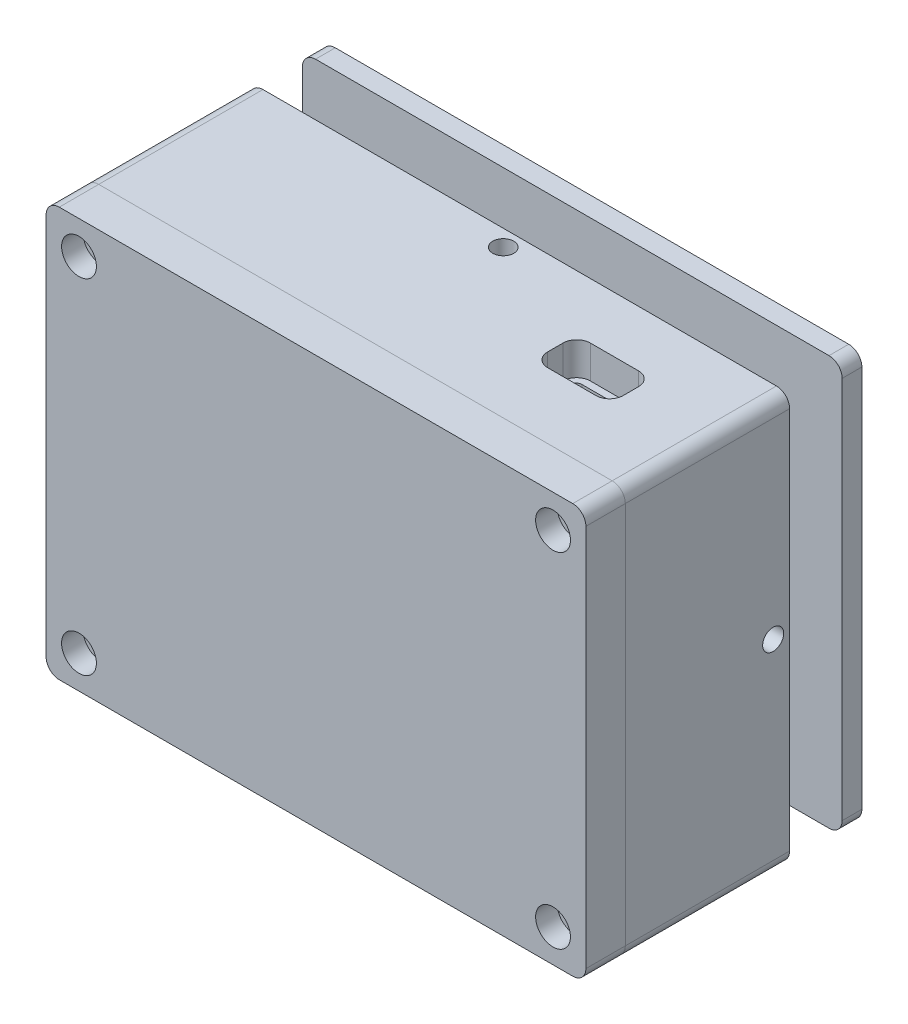
from build123d import *
from OCP.BRepFilletAPI import BRepFilletAPI_MakeChamfer

# Parameters (mm, degrees)
SKETCH1_W                = 70
SKETCH1_H                = 50
BOSS_EXTRUDE1_DEPTH      = 2
BOSS_EXTRUDE2_DEPTH      = 21
EXTRUDE_THIN1_DEPTH      = 10
EXTRUDE_THIN1_DEPTH_BACK = 23
SKETCH3_W                = 82.141201594
SKETCH3_H                = 62.29
SKETCH3_W_2              = 76.141201594
SKETCH3_H_2              = 56.29
SKETCH4_W                = 76.141201594
SKETCH4_H                = 56.29
BOSS_EXTRUDE3_DEPTH      = 6
FILLET1_R                = 2
BOSS_EXTRUDE4_DEPTH      = 3
BOSS_EXTRUDE8_DEPTH      = 10
CUT_EXTRUDE1_DEPTH       = 8
CUT_EXTRUDE2_DEPTH       = 8
EXTRUDE_THIN2_DEPTH      = 6
BOSS_EXTRUDE9_START      = 2
BOSS_EXTRUDE9_DEPTH      = 1
FILLET2_R                = 3
SKETCH11_R               = 1.8
CUT_EXTRUDE3_DEPTH       = 5
CUT_EXTRUDE4_DEPTH       = 88.160559078
CUT_EXTRUDE4_DEPTH_BACK  = 88.160559078
SKETCH12_R               = 1.6
CUT_EXTRUDE5_DEPTH       = 92.040453046
CUT_EXTRUDE5_DEPTH_BACK  = 92.040453046
SKETCH13_R               = 1.6
SKETCH14_R               = 1.6
BOSS_EXTRUDE10_DEPTH     = 5
BOSS_EXTRUDE11_DEPTH     = 1
CHAMFER1_SIZE            = 4
CHAMFER1_SIZE2           = 2.309401077
SKETCH16_R               = 1.6
CUT_EXTRUDE6_DEPTH       = 75.13572722
SKETCH17_R               = 2.65
CUT_EXTRUDE7_DEPTH       = 3.3


with BuildPart() as part:
    # Sketch1 → Boss-Extrude1 (new body)
    with BuildSketch(Plane.XY):
        with Locations((-17.311659193, -1.674887892)):
            Rectangle(SKETCH1_W, SKETCH1_H)
    extrude(amount=BOSS_EXTRUDE1_DEPTH)

    # Sketch2 → Boss-Extrude2 (add)
    with BuildSketch(Plane.XY.offset(2)):
        Polygon((-42.790623702, 27.325112108), (-53.311659193, 9.150739706), (12.029536823, -28.674887892), (22.550572314, -10.500515491), align=None)
    extrude(amount=BOSS_EXTRUDE2_DEPTH)


with BuildPart() as body_2:
    # Sketch3 → Extrude-Thin1 (new, two sides: drawn at the far end of the back side and taken through both)
    with BuildSketch(Plane(origin=(0, 0, 0), x_dir=(-1, 0, 0), z_dir=(0, 0, -1)).offset(-EXTRUDE_THIN1_DEPTH_BACK)):
        with Locations((15.391058396, -0.669887892)):
            Rectangle(SKETCH3_W, SKETCH3_H)
        with Locations((15.391058396, -0.669887892)):
            Rectangle(SKETCH3_W_2, SKETCH3_H_2, mode=Mode.SUBTRACT)
    extrude(amount=EXTRUDE_THIN1_DEPTH + EXTRUDE_THIN1_DEPTH_BACK)

    # Sketch4 → Boss-Extrude3 (add)
    with BuildSketch(Plane.XY.offset(23)):
        with Locations((-15.391058396, -0.669887892)):
            Rectangle(SKETCH4_W, SKETCH4_H)
        Polygon((-42.790623702, 27.325112108), (-53.311659193, 9.150739706), (12.029536823, -28.674887892), (22.550572314, -10.500515491), align=None, mode=Mode.SUBTRACT)
    extrude(amount=-BOSS_EXTRUDE3_DEPTH)

    # Fillet1
    fillet1_edges = [body_2.edges().sort_by_distance(p)[0] for p in [
        (-56.461659193, 30.475112108, 6.5),
        (-56.461659193, -31.814887892, 6.5),
        (25.679542401, -31.814887892, 6.5),
        (25.679542401, 30.475112108, 6.5),
    ]]
    fillet(fillet1_edges, radius=FILLET1_R)

    # Sketch6 → Boss-Extrude8 (add)
    with BuildSketch(Plane(origin=(0, 0, 17), x_dir=(-1, 0, 0), z_dir=(0, 0, -1))):
        Polygon((-16.679542401, 27.475112108), (-22.679542401, 22.532519231), (-22.679542401, 27.475112108), align=None)
        Polygon((42.790623702, 27.325112108), (53.311659193, 9.150739706), (53.461659193, 27.475112108), (42.790623702, 27.475112108), align=None)
        Polygon((-12.029536823, -28.674887892), (-22.550572314, -10.500515491), (-22.679542401, -10.500515491), (-22.679542401, -28.814887892), (53.461659193, -28.814887892), (53.461659193, -25.814887892), (-7.089081569, -25.814887892), align=None)
    extrude(amount=BOSS_EXTRUDE8_DEPTH)

    # Sketch7 → Cut-Extrude1 (cut)
    with BuildSketch(Plane(origin=(0, 0, -10), x_dir=(-1, 0, 0), z_dir=(0, 0, -1))):
        Polygon((-28.614884021, 33.287753378), (-28.614884021, -37.390774311), (75.821884566, -37.390774311), (71.624058107, 45.166479381), align=None)
    extrude(amount=-CUT_EXTRUDE1_DEPTH, mode=Mode.SUBTRACT)

    # Sketch8 → Cut-Extrude2 (cut)
    with BuildSketch(Plane(origin=(0, 30.475112108, 0), x_dir=(1, 0, 0), z_dir=(0, 1, 0))):
        with BuildLine():
            Line((1.779542401, -8.574068331), (1.779542401, -10.925931669))
            ThreePointArc((1.779542401, -10.925931669), (2.38702295, -12.392519451), (3.853610732, -13))
            Line((3.853610732, -13), (11.20547407, -13))
            ThreePointArc((11.20547407, -13), (12.672061852, -12.392519451), (13.279542401, -10.925931669))
            Line((13.279542401, -10.925931669), (13.279542401, -8.574068331))
            ThreePointArc((13.279542401, -8.574068331), (12.672061852, -7.107480549), (11.20547407, -6.5))
            Line((11.20547407, -6.5), (3.853610732, -6.5))
            ThreePointArc((3.853610732, -6.5), (2.38702295, -7.107480549), (1.779542401, -8.574068331))
        make_face()
    extrude(amount=-CUT_EXTRUDE2_DEPTH, mode=Mode.SUBTRACT)

    # Sketch8<2> → Extrude-Thin2 (add)
    with BuildSketch(Plane(origin=(0, 30.475112108, 0), x_dir=(1, 0, 0), z_dir=(0, 1, 0))):
        with BuildLine():
            Line((-0.220457599, -8.574068331), (-0.220457599, -10.925931669))
            ThreePointArc((-0.220457599, -10.925931669), (0.972809388, -13.806733013), (3.853610732, -15))
            Line((3.853610732, -15), (11.20547407, -15))
            ThreePointArc((11.20547407, -15), (14.086275414, -13.806733013), (15.279542401, -10.925931669))
            Line((15.279542401, -10.925931669), (15.279542401, -8.574068331))
            ThreePointArc((15.279542401, -8.574068331), (14.086275414, -5.693266987), (11.20547407, -4.5))
            Line((11.20547407, -4.5), (3.853610732, -4.5))
            ThreePointArc((3.853610732, -4.5), (0.972809388, -5.693266987), (-0.220457599, -8.574068331))
        make_face()
        with BuildLine():
            Line((1.779542401, -8.574068331), (1.779542401, -10.925931669))
            ThreePointArc((1.779542401, -10.925931669), (2.38702295, -12.392519451), (3.853610732, -13))
            Line((3.853610732, -13), (11.20547407, -13))
            ThreePointArc((11.20547407, -13), (12.672061852, -12.392519451), (13.279542401, -10.925931669))
            Line((13.279542401, -10.925931669), (13.279542401, -8.574068331))
            ThreePointArc((13.279542401, -8.574068331), (12.672061852, -7.107480549), (11.20547407, -6.5))
            Line((11.20547407, -6.5), (3.853610732, -6.5))
            ThreePointArc((3.853610732, -6.5), (2.38702295, -7.107480549), (1.779542401, -8.574068331))
        make_face(mode=Mode.SUBTRACT)
    extrude(amount=-EXTRUDE_THIN2_DEPTH)

    # Sketch10 → Boss-Extrude9 (add)
    with BuildSketch(Plane.XZ.offset(-27.475112108).offset(BOSS_EXTRUDE9_START)):
        with BuildLine():
            Line((1.779542401, 8.574068331), (1.779542401, 10.925931669))
            ThreePointArc((1.779542401, 10.925931669), (2.38702295, 12.392519451), (3.853610732, 13))
            Line((3.853610732, 13), (11.20547407, 13))
            ThreePointArc((11.20547407, 13), (12.672061852, 12.392519451), (13.279542401, 10.925931669))
            Line((13.279542401, 10.925931669), (13.279542401, 8.574068331))
            ThreePointArc((13.279542401, 8.574068331), (12.672061852, 7.107480549), (11.20547407, 6.5))
            Line((11.20547407, 6.5), (3.853610732, 6.5))
            ThreePointArc((3.853610732, 6.5), (2.38702295, 7.107480549), (1.779542401, 8.574068331))
        make_face()
        with BuildLine():
            Line((3.679542401, 11.9), (11.379542401, 11.9))
            ThreePointArc((11.379542401, 11.9), (12.086649182, 11.607106781), (12.379542401, 10.9))
            Line((12.379542401, 10.9), (12.379542401, 8.6))
            ThreePointArc((12.379542401, 8.6), (12.086649182, 7.892893219), (11.379542401, 7.6))
            Line((11.379542401, 7.6), (3.679542401, 7.6))
            ThreePointArc((3.679542401, 7.6), (2.97243562, 7.892893219), (2.679542401, 8.6))
            Line((2.679542401, 8.6), (2.679542401, 10.9))
            ThreePointArc((2.679542401, 10.9), (2.97243562, 11.607106781), (3.679542401, 11.9))
        make_face(mode=Mode.SUBTRACT)
    extrude(amount=BOSS_EXTRUDE9_DEPTH)

    # Fillet2
    # the kernel refuses this fillet: 3 mm, written as the material it takes off along each edge
    with BuildSketch(Plane(origin=(3.853610732, 24.475112108, 15), x_dir=(0, 1, 0), z_dir=(1, 0, 0)), Plane(origin=(11.20547407, 24.475112108, 4.5), x_dir=(0, 1, 0), z_dir=(-1, 0, 0))) as fillet2_piece_1:
        with BuildLine():
            CenterArc((FILLET2_R, -FILLET2_R), FILLET2_R, 90, 90)
            Line((0, -FILLET2_R), (0, 0))
            Line((0, 0), (FILLET2_R, 0))
        make_face()
    extrude(amount=7.351863339, mode=Mode.SUBTRACT)
    with BuildSketch(Plane(origin=(11.20547407, 24.475112108, 10.925931669), x_dir=(0, 0, 1), z_dir=(-1, 0, 0))) as fillet2_piece_2:
        with BuildLine():
            CenterArc((4.074068331 - FILLET2_R, FILLET2_R), FILLET2_R, 270, 90)
            Line((4.074068331 - FILLET2_R, 0), (4.074068331, 0))
            Line((4.074068331, 0), (4.074068331, FILLET2_R))
        make_face()
    revolve(axis=Axis((11.20547407, 24.475112108, 10.925931669), (0, 1, 0)), revolution_arc=90, mode=Mode.SUBTRACT)
    with BuildSketch(Plane(origin=(11.20547407, 24.475112108, 8.574068331), x_dir=(1, 0, 0), z_dir=(0, 0, 1))) as fillet2_piece_3:
        with BuildLine():
            CenterArc((4.074068331 - FILLET2_R, FILLET2_R), FILLET2_R, 270, 90)
            Line((4.074068331 - FILLET2_R, 0), (4.074068331, 0))
            Line((4.074068331, 0), (4.074068331, FILLET2_R))
        make_face()
    revolve(axis=Axis((11.20547407, 24.475112108, 8.574068331), (0, 1, 0)), revolution_arc=90, mode=Mode.SUBTRACT)
    with BuildSketch(Plane(origin=(3.853610732, 24.475112108, 8.574068331), x_dir=(0, 0, -1), z_dir=(1, 0, 0))) as fillet2_piece_4:
        with BuildLine():
            CenterArc((4.074068331 - FILLET2_R, FILLET2_R), FILLET2_R, 270, 90)
            Line((4.074068331 - FILLET2_R, 0), (4.074068331, 0))
            Line((4.074068331, 0), (4.074068331, FILLET2_R))
        make_face()
    revolve(axis=Axis((3.853610732, 24.475112108, 8.574068331), (0, 1, 0)), revolution_arc=90, mode=Mode.SUBTRACT)
    with BuildSketch(Plane(origin=(3.853610732, 24.475112108, 10.925931669), x_dir=(-1, 0, 0), z_dir=(0, 0, -1))) as fillet2_piece_5:
        with BuildLine():
            CenterArc((4.074068331 - FILLET2_R, FILLET2_R), FILLET2_R, 270, 90)
            Line((4.074068331 - FILLET2_R, 0), (4.074068331, 0))
            Line((4.074068331, 0), (4.074068331, FILLET2_R))
        make_face()
    revolve(axis=Axis((3.853610732, 24.475112108, 10.925931669), (0, 1, 0)), revolution_arc=90, mode=Mode.SUBTRACT)
    with BuildSketch(Plane(origin=(-0.220457599, 24.475112108, 8.574068331), x_dir=(0, 1, 0), z_dir=(0, 0, 1)), Plane(origin=(15.279542401, 24.475112108, 10.925931669), x_dir=(0, 1, 0), z_dir=(0, 0, -1))) as fillet2_piece_6:
        with BuildLine():
            CenterArc((FILLET2_R, -FILLET2_R), FILLET2_R, 90, 90)
            Line((0, -FILLET2_R), (0, 0))
            Line((0, 0), (FILLET2_R, 0))
        make_face()
    extrude(amount=2.351863339, mode=Mode.SUBTRACT)

    # Sketch11 → Cut-Extrude3 (cut)
    with BuildSketch(Plane.XY.offset(23)):
        with Locations((-51.461659193, 25.475112108)):
            Circle(SKETCH11_R)
        with Locations(Location((-51.461659193, -26.814887892, 0), (0, 0, 180))):
            Circle(SKETCH11_R)
        with Locations((20.679542401, -26.814887892)):
            Circle(SKETCH11_R)
        with Locations(Location((20.679542401, 25.475112108, 0), (0, 0, 180))):
            Circle(SKETCH11_R)
    extrude(amount=-CUT_EXTRUDE3_DEPTH, mode=Mode.SUBTRACT)

    # Sketch12 → Cut-Extrude4 (cut, two sides: drawn at the far end of the back side and taken through both)
    with BuildSketch(Plane(origin=(0, 30.475112108, 0), x_dir=(1, 0, 0), z_dir=(0, 1, 0)).offset(-CUT_EXTRUDE4_DEPTH_BACK)):
        with Locations(Location((-15.391058396, -0.5, 0), (0, 0, 180))):
            Circle(SKETCH12_R)
    extrude(amount=CUT_EXTRUDE4_DEPTH + CUT_EXTRUDE4_DEPTH_BACK, mode=Mode.SUBTRACT)

    # Sketch13 → Cut-Extrude5 (cut, two sides: drawn at the far end of the back side and taken through both)
    with BuildSketch(Plane(origin=(25.679542401, 0, 0), x_dir=(0, 0, -1), z_dir=(1, 0, 0)).offset(-CUT_EXTRUDE5_DEPTH_BACK)):
        with Locations(Location((-0.5, -0.669887892, 0), (0, 0, 90))):
            Circle(SKETCH13_R)
    extrude(amount=CUT_EXTRUDE5_DEPTH + CUT_EXTRUDE5_DEPTH_BACK, mode=Mode.SUBTRACT)


with BuildPart() as body_3:
    # Sketch5 → Boss-Extrude4 (new body)
    with BuildSketch(Plane(origin=(0, 0, -10), x_dir=(-1, 0, 0), z_dir=(0, 0, -1))):
        with BuildLine():
            Line((-25.679542401, 28.475112108), (-25.679542401, -29.814887892))
            ThreePointArc((-25.679542401, -29.814887892), (-25.093755963, -31.229101455), (-23.679542401, -31.814887892))
            Line((-23.679542401, -31.814887892), (54.461659193, -31.814887892))
            ThreePointArc((54.461659193, -31.814887892), (55.875872755, -31.229101455), (56.461659193, -29.814887892))
            Line((56.461659193, -29.814887892), (56.461659193, 28.475112108))
            ThreePointArc((56.461659193, 28.475112108), (55.875872755, 29.88932567), (54.461659193, 30.475112108))
            Line((54.461659193, 30.475112108), (-23.679542401, 30.475112108))
            ThreePointArc((-23.679542401, 30.475112108), (-25.093755963, 29.88932567), (-25.679542401, 28.475112108))
        make_face()
    extrude(amount=BOSS_EXTRUDE4_DEPTH)


with BuildPart() as body_4:
    # Sketch14 → Boss-Extrude10 (new body)
    with BuildSketch(Plane.XY.offset(23)):
        with BuildLine():
            Line((23.679542401, -31.814887892), (-54.461659193, -31.814887892))
            ThreePointArc((-54.461659193, -31.814887892), (-55.875872755, -31.229101455), (-56.461659193, -29.814887892))
            Line((-56.461659193, -29.814887892), (-56.461659193, 28.475112108))
            ThreePointArc((-56.461659193, 28.475112108), (-55.875872755, 29.88932567), (-54.461659193, 30.475112108))
            Line((-54.461659193, 30.475112108), (23.679542401, 30.475112108))
            ThreePointArc((23.679542401, 30.475112108), (25.093755963, 29.88932567), (25.679542401, 28.475112108))
            Line((25.679542401, 28.475112108), (25.679542401, -29.814887892))
            ThreePointArc((25.679542401, -29.814887892), (25.093755963, -31.229101455), (23.679542401, -31.814887892))
        make_face()
        with Locations((-51.461659193, 25.475112108)):
            Circle(SKETCH14_R, mode=Mode.SUBTRACT)
        with Locations((20.679542401, 25.475112108)):
            Circle(SKETCH14_R, mode=Mode.SUBTRACT)
        with Locations((-51.461659193, -26.814887892)):
            Circle(SKETCH14_R, mode=Mode.SUBTRACT)
        with Locations((20.679542401, -26.814887892)):
            Circle(SKETCH14_R, mode=Mode.SUBTRACT)
        Polygon((-42.790623702, 27.325112108), (-53.311659193, 9.150739706), (12.029536823, -28.674887892), (22.550572314, -10.500515491), align=None, mode=Mode.SUBTRACT)
    extrude(amount=BOSS_EXTRUDE10_DEPTH)

    # Sketch15 → Boss-Extrude11 (add)
    with BuildSketch(Plane.XY.offset(28)):
        with BuildLine():
            Line((-56.461659193, 28.475112108), (-56.461659193, -29.814887892))
            ThreePointArc((-56.461659193, -29.814887892), (-55.875872755, -31.229101455), (-54.461659193, -31.814887892))
            Line((-54.461659193, -31.814887892), (23.679542401, -31.814887892))
            ThreePointArc((23.679542401, -31.814887892), (25.093755963, -31.229101455), (25.679542401, -29.814887892))
            Line((25.679542401, -29.814887892), (25.679542401, 28.475112108))
            ThreePointArc((25.679542401, 28.475112108), (25.093755963, 29.88932567), (23.679542401, 30.475112108))
            Line((23.679542401, 30.475112108), (-54.461659193, 30.475112108))
            ThreePointArc((-54.461659193, 30.475112108), (-55.875872755, 29.88932567), (-56.461659193, 28.475112108))
        make_face()
    extrude(amount=BOSS_EXTRUDE11_DEPTH)

    # Chamfer1: one chamfer whose edges measure the first distance from different faces: ONE call of the kernel's chamfer builder (chamfer() names one face for all edges)
    chamfer1_edges_1 = [body_4.edges().sort_by_distance(p)[0] for p in [
        (-10.120025694, 8.412298309, 23),
    ]]
    chamfer1_side_1 = [body_4.faces().sort_by_distance(p)[0] for p in [
        (-10.120025694, 8.412298309, 25.5),
    ]]
    chamfer1_edges_2 = [body_4.edges().sort_by_distance(p)[0] for p in [
        (-20.641061185, -9.762074093, 23),
    ]]
    chamfer1_side_2 = [body_4.faces().sort_by_distance(p)[0] for p in [
        (-20.641061185, -9.762074093, 25.5),
    ]]
    chamfer1 = BRepFilletAPI_MakeChamfer(body_4.part.solid().wrapped)
    for e in chamfer1_edges_1:
        chamfer1.Add(CHAMFER1_SIZE, CHAMFER1_SIZE2, e.wrapped, chamfer1_side_1[0].wrapped)  # the first distance lies on this face
    for e in chamfer1_edges_2:
        chamfer1.Add(CHAMFER1_SIZE, CHAMFER1_SIZE2, e.wrapped, chamfer1_side_2[0].wrapped)  # the first distance lies on this face
    add(Compound.cast(chamfer1.Shape()), mode=Mode.REPLACE)

    # Sketch16 → Cut-Extrude6 (cut, through all)
    with BuildSketch(Plane(origin=(0, 0, 23), x_dir=(-1, 0, 0), z_dir=(0, 0, -1))):
        with Locations((-20.679542401, 25.475112108)):
            Circle(SKETCH16_R)
        with Locations((51.461659193, -26.814887892)):
            Circle(SKETCH16_R)
        with Locations((-20.679542401, -26.814887892)):
            Circle(SKETCH16_R)
        with Locations((51.461659193, 25.475112108)):
            Circle(SKETCH16_R)
    extrude(amount=-CUT_EXTRUDE6_DEPTH, mode=Mode.SUBTRACT)

    # Sketch17 → Cut-Extrude7 (cut)
    with BuildSketch(Plane.XY.offset(29)):
        with Locations((-51.461659193, 25.475112108)):
            Circle(SKETCH17_R)
        with Locations((-51.461659193, -26.814887892)):
            Circle(SKETCH17_R)
        with Locations((20.679542401, 25.475112108)):
            Circle(SKETCH17_R)
        with Locations((20.679542401, -26.814887892)):
            Circle(SKETCH17_R)
    extrude(amount=-CUT_EXTRUDE7_DEPTH, mode=Mode.SUBTRACT)


solid = Compound([part.part, body_2.part, body_3.part, body_4.part])
